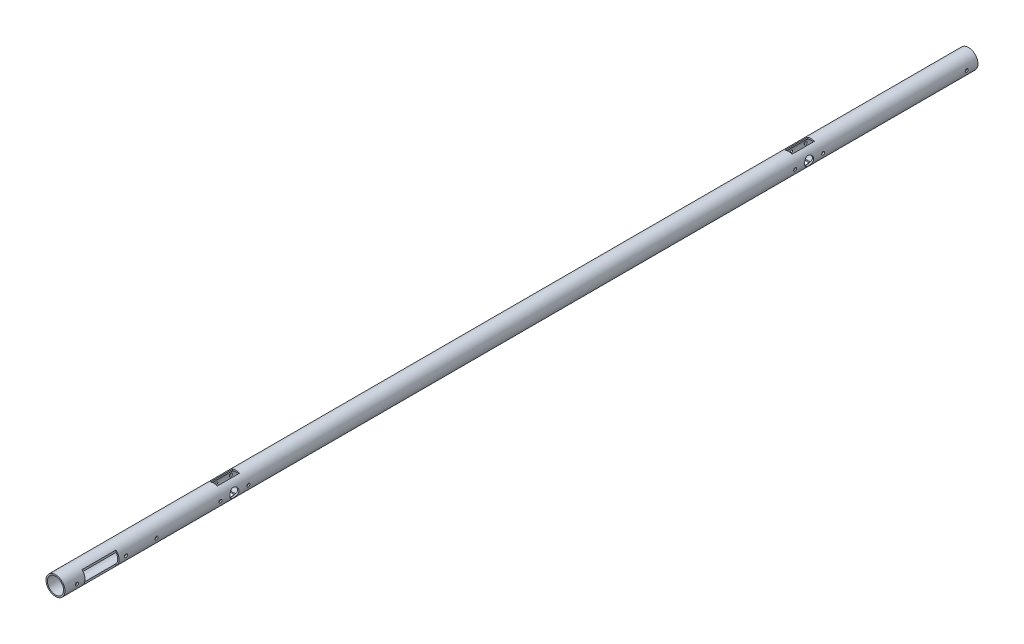
from build123d import *

# Parameters (mm, degrees)
SKETCH1_R               = 9.36
SKETCH1_R_2             = 7.99
EXTRUDE1_DEPTH          = 900
SKETCH4_W               = 7
SKETCH4_H               = 22
CUT_EXTRUDE3_DEPTH      = 901.097338736
SKETCH5_W               = 7
SKETCH5_H               = 16
CUT_EXTRUDE4_DEPTH      = 901.097338736
SKETCH6_R               = 1
SKETCH6_R_2             = 1.5
CUT_EXTRUDE5_DEPTH      = 901.097338736
SKETCH7_R               = 4.5
CUT_EXTRUDE6_DEPTH      = 901.097338838
CUT_EXTRUDE7_DEPTH      = 901.097338838
CUT_EXTRUDE7_DEPTH_BACK = 901.097338838
SKETCH8_R               = 1.5
SKETCH8_R_2             = 1.55
CUT_EXTRUDE8_DEPTH      = 901.097338838
CUT_EXTRUDE8_DEPTH_BACK = 901.097338838
SKETCH9_W               = 6.14
SKETCH9_H               = 33.5


with BuildPart() as part:
    # Sketch1 → Extrude1 (new body)
    with BuildSketch(Plane.XY):
        Circle(SKETCH1_R)
        Circle(SKETCH1_R_2, mode=Mode.SUBTRACT)
    extrude(amount=EXTRUDE1_DEPTH)

    # Sketch4 → Cut-Extrude3 (cut, through all)
    with BuildSketch(Plane(origin=(0, 0, 0), x_dir=(1, 0, 0), z_dir=(0, 1, 0))):
        with Locations((0, -166.425)):
            Rectangle(SKETCH4_W, SKETCH4_H)
        with Locations((0, -733)):
            Rectangle(SKETCH4_W, SKETCH4_H)
    extrude(amount=CUT_EXTRUDE3_DEPTH, mode=Mode.SUBTRACT)

    # Sketch5 → Cut-Extrude4 (cut, through all)
    with BuildSketch(Plane(origin=(0, 0, 0), x_dir=(1, 0, 0), z_dir=(0, 1, 0))):
        with Locations((0, -166.425)):
            Rectangle(SKETCH5_W, SKETCH5_H)
        with Locations((0, -733)):
            Rectangle(SKETCH5_W, SKETCH5_H)
    extrude(amount=-CUT_EXTRUDE4_DEPTH, mode=Mode.SUBTRACT)

    # Sketch6 → Cut-Extrude5 (cut, through all)
    with BuildSketch(Plane(origin=(0, 0, 0), x_dir=(0, 0, -1), z_dir=(1, 0, 0))):
        with Locations((-166.425, 0)):
            Circle(SKETCH6_R)
        with Locations((-733, 0)):
            Circle(SKETCH6_R)
        with Locations((-282.57, 0)):
            Circle(SKETCH6_R_2)
    extrude(amount=-CUT_EXTRUDE5_DEPTH, mode=Mode.SUBTRACT)

    # Sketch7 → Cut-Extrude6 (cut, through all)
    with BuildSketch(Plane(origin=(0, 0, 0), x_dir=(0, 0, -1), z_dir=(1, 0, 0))):
        with Locations((-166.425, 0)):
            Circle(SKETCH7_R)
        with Locations((-733, 0)):
            Circle(SKETCH7_R)
    extrude(amount=CUT_EXTRUDE6_DEPTH, mode=Mode.SUBTRACT)

    # Sketch8 → Cut-Extrude7 (cut, two sides: drawn at the far end of the back side and taken through both)
    with BuildSketch(Plane(origin=(0, 0, 0), x_dir=(0, 0, -1), z_dir=(1, 0, 0)).offset(-CUT_EXTRUDE7_DEPTH_BACK)):
        with Locations((-152.61375, 0)):
            Circle(SKETCH8_R)
        with Locations((-180.17625, 0)):
            Circle(SKETCH8_R)
        with Locations((-746.75125, 0)):
            Circle(SKETCH8_R)
        with Locations((-719.18875, 0)):
            Circle(SKETCH8_R)
        with Locations((-809.725, 0)):
            Circle(SKETCH8_R_2)
        with Locations((-839.885, 0)):
            Circle(SKETCH8_R_2)
        with Locations((-888.255, 0)):
            Circle(SKETCH8_R_2)
        with Locations((-11.1125, 0)):
            Circle(SKETCH8_R)
    extrude(amount=CUT_EXTRUDE7_DEPTH + CUT_EXTRUDE7_DEPTH_BACK, mode=Mode.SUBTRACT)

    # Sketch9 → Cut-Extrude8 (cut, two sides: drawn at the far end of the back side and taken through both)
    with BuildSketch(Plane(origin=(0, 0, 0), x_dir=(1, 0, 0), z_dir=(0, 1, 0)).offset(-CUT_EXTRUDE8_DEPTH_BACK)):
        with Locations((9.43, -863.425)):
            Rectangle(SKETCH9_W, SKETCH9_H)
    extrude(amount=CUT_EXTRUDE8_DEPTH + CUT_EXTRUDE8_DEPTH_BACK, mode=Mode.SUBTRACT)


solid = part.part
